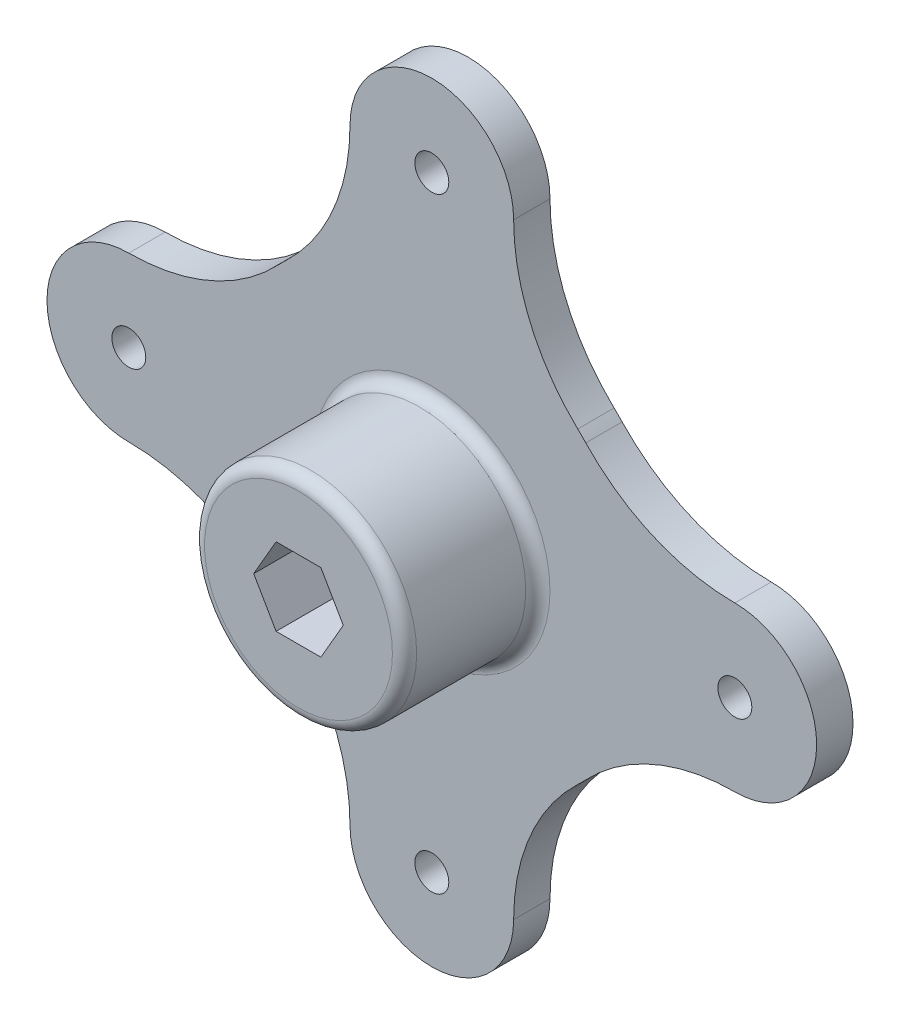
from build123d import *

# Parameters (mm, degrees)
SKETCH2_R           = 8.75
BOSS_EXTRUDE1_DEPTH = 14
SKETCH3_R           = 1.4
BOSS_EXTRUDE2_DEPTH = 3
FILLET1_R           = 1
CUT_EXTRUDE2_REACH  = 49.033


with BuildPart() as part:
    # Sketch2 → Boss-Extrude1 (new body)
    with BuildSketch(Plane.XY):
        Circle(SKETCH2_R)
    extrude(amount=BOSS_EXTRUDE1_DEPTH)

    # Sketch3 → Boss-Extrude2 (add)
    with BuildSketch(Plane.XY):
        with BuildLine():
            ThreePointArc((12.038357667, 12.701493797), (8.128131702, 18.306346632), (6.75, 25))
            ThreePointArc((6.75, 25), (0, 31.75), (-6.75, 25))
            ThreePointArc((-6.75, 25), (-8.128131702, 18.306346632), (-12.038357667, 12.701493797))
            ThreePointArc((-12.038357667, 12.701493797), (-12.374368671, 12.374368671), (-12.701493797, 12.038357667))
            ThreePointArc((-12.701493797, 12.038357667), (-18.306346632, 8.128131702), (-25, 6.75))
            ThreePointArc((-25, 6.75), (-31.75, 0), (-25, -6.75))
            ThreePointArc((-25, -6.75), (-18.306346632, -8.128131702), (-12.701493797, -12.038357667))
            ThreePointArc((-12.701493797, -12.038357667), (-12.374368671, -12.374368671), (-12.038357667, -12.701493797))
            ThreePointArc((-12.038357667, -12.701493797), (-8.128131702, -18.306346632), (-6.75, -25))
            ThreePointArc((-6.75, -25), (0, -31.75), (6.75, -25))
            ThreePointArc((6.75, -25), (8.128131702, -18.306346632), (12.038357667, -12.701493797))
            ThreePointArc((12.038357667, -12.701493797), (12.374368671, -12.374368671), (12.701493797, -12.038357667))
            ThreePointArc((12.701493797, -12.038357667), (18.306346632, -8.128131702), (25, -6.75))
            ThreePointArc((25, -6.75), (31.75, 0), (25, 6.75))
            ThreePointArc((25, 6.75), (18.306346632, 8.128131702), (12.701493797, 12.038357667))
            ThreePointArc((12.701493797, 12.038357667), (12.374368671, 12.374368671), (12.038357667, 12.701493797))
        make_face()
        with Locations((-25, 0)):
            Circle(SKETCH3_R, mode=Mode.SUBTRACT)
        with Locations((0, -25)):
            Circle(SKETCH3_R, mode=Mode.SUBTRACT)
        with Locations((0, 25)):
            Circle(SKETCH3_R, mode=Mode.SUBTRACT)
        with Locations((25, 0)):
            Circle(SKETCH3_R, mode=Mode.SUBTRACT)
    extrude(amount=BOSS_EXTRUDE2_DEPTH)

    # Fillet1
    fillet1_edges = [part.edges().sort_by_distance(p)[0] for p in [
        (-8.75, 0, 3),
        (-8.75, 0, 14),
    ]]
    fillet(fillet1_edges, radius=FILLET1_R)

    # Sketch1 → Cut-Extrude2 (cut, up to next)
    with BuildSketch(Plane.XY, mode=Mode.PRIVATE) as cut_extrude2_sk1:
        Polygon((3.695041723, 0), (1.847520861, 3.2), (-1.847520861, 3.2), (-3.695041723, 0), (-1.847520861, -3.2), (1.847520861, -3.2), align=None)
    cut_extrude2_tool1 = extrude(cut_extrude2_sk1.sketch, amount=CUT_EXTRUDE2_REACH, mode=Mode.PRIVATE) & part.part
    add(cut_extrude2_tool1.solids().sort_by_distance((0, 0, 0))[0], mode=Mode.SUBTRACT)


solid = part.part
